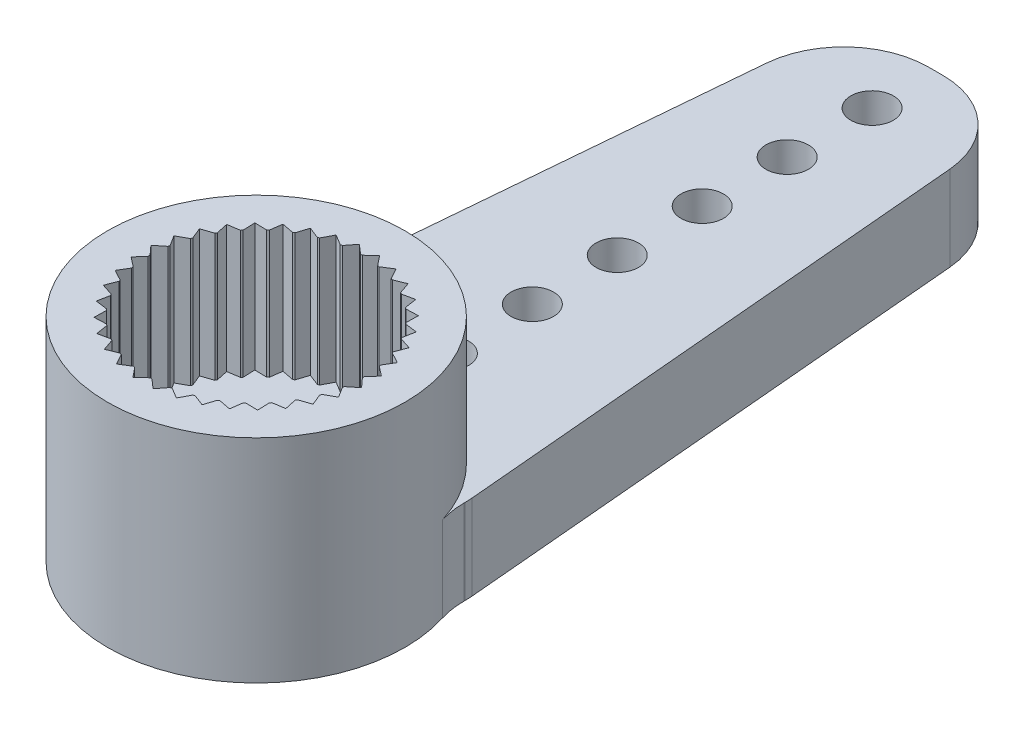
from build123d import *

# Parameters (mm, degrees)
BOSS_EXTRUDE1_DEPTH      = 2
FILLET1_R                = 2
BOSS_EXTRUDE2_DEPTH      = 3
BOSS_EXTRUDE2_DEPTH_BACK = 2
SKETCH2_R                = 3.5
SKETCH3_R                = 2.5
CUT_EXTRUDE1_DEPTH       = 1
SKETCH4_R                = 1
CUT_EXTRUDE2_DEPTH       = 17.8597153
CUT_EXTRUDE3_START       = -3
SKETCH5_R                = 2.5
CUT_EXTRUDE3_DEPTH       = 3
CUT_EXTRUDE4_DEPTH       = 3
CIRPATTERN1_COUNT        = 36
SKETCH9_R                = 0.5
CUT_EXTRUDE5_DEPTH       = 18.12454379
LPATTERN1_COUNT          = 6
LPATTERN1_PITCH          = 2
FILLET3_R                = 2


with BuildPart() as part:
    # Sketch1 → Boss-Extrude1 (new body)
    with BuildSketch(Plane(origin=(0, 0, 0), x_dir=(1, 0, 0), z_dir=(0, 1, 0))):
        Polygon((-3.25, 0), (-3.25, 1.75), (-2, 16), (2, 16), (3.25, 1.75), (3.25, 0), align=None)
    extrude(amount=BOSS_EXTRUDE1_DEPTH)

    # Fillet1
    fillet1_edges = [part.edges().sort_by_distance(p)[0] for p in [
        (-2, 1, -16),
        (2, 1, -16),
    ]]
    fillet(fillet1_edges, radius=FILLET1_R)

    # Sketch2 → Boss-Extrude2 (add, two sides: drawn at the far end of the back side and taken through both)
    with BuildSketch(Plane(origin=(0, 2, 0), x_dir=(1, 0, 0), z_dir=(0, 1, 0)).offset(-BOSS_EXTRUDE2_DEPTH_BACK)):
        with Locations(Location((0, 0, 0), (0, 0, 270))):
            Circle(SKETCH2_R)
    extrude(amount=BOSS_EXTRUDE2_DEPTH + BOSS_EXTRUDE2_DEPTH_BACK)

    # Sketch3 → Cut-Extrude1 (cut)
    with BuildSketch(Plane(origin=(0, 0, 0), x_dir=(-1, 0, 0), z_dir=(0, -1, 0))):
        with Locations(Location((0, 0, 0), (0, 0, 90))):
            Circle(SKETCH3_R)
    extrude(amount=-CUT_EXTRUDE1_DEPTH, mode=Mode.SUBTRACT)

    # Sketch4 → Cut-Extrude2 (cut, through all)
    with BuildSketch(Plane(origin=(0, 1, 0), x_dir=(-1, 0, 0), z_dir=(0, -1, 0))):
        with Locations(Location((0, 0, 0), (0, 0, 90))):
            Circle(SKETCH4_R)
    extrude(amount=-CUT_EXTRUDE2_DEPTH, mode=Mode.SUBTRACT)

    # Sketch5 → Cut-Extrude3 (cut)
    with BuildSketch(Plane(origin=(0, 5, 0), x_dir=(1, 0, 0), z_dir=(0, 1, 0)).offset(CUT_EXTRUDE3_START)):
        with Locations(Location((0, 0, 0), (0, 0, 90))):
            Circle(SKETCH5_R)
    extrude(amount=CUT_EXTRUDE3_DEPTH, mode=Mode.SUBTRACT)

    # Sketch6 → Cut-Extrude4 (cut)
    with BuildSketch(Plane(origin=(0, 5, 0), x_dir=(1, 0, 0), z_dir=(0, 1, 0))):
        Polygon((-2.5, 0), (-2.691676801, 0.211839558), (-2.469220851, 0.391086163), align=None)
    cut_extrude4 = extrude(amount=-CUT_EXTRUDE4_DEPTH, mode=Mode.SUBTRACT)

    # CirPattern1: Cut-Extrude4 ×36 about axis
    cirpattern1_axis = Axis((0, 0, 0), (0, 1, 0))
    for i in range(1, CIRPATTERN1_COUNT):
        add(cut_extrude4.rotate(cirpattern1_axis, i * 360 / CIRPATTERN1_COUNT), mode=Mode.SUBTRACT)

    # Sketch9 → Cut-Extrude5 (cut, through all)
    with BuildSketch(Plane(origin=(0, 0, 0), x_dir=(-1, 0, 0), z_dir=(0, -1, 0))):
        with Locations(Location((0, 14.5, 0), (0, 0, 90))):
            Circle(SKETCH9_R)
    cut_extrude5 = extrude(amount=-CUT_EXTRUDE5_DEPTH, mode=Mode.SUBTRACT)

    # LPattern1: Cut-Extrude5 ×6
    with Locations(*[(0, 0, i * LPATTERN1_PITCH) for i in range(1, LPATTERN1_COUNT)]):
        add(cut_extrude5, mode=Mode.SUBTRACT)

    # Fillet3
    # the kernel refuses this fillet: 2 mm, written as the material it adds along each edge
    with BuildSketch(Plane(origin=(-3.25, 0, -1.299038106), x_dir=(0, 0, -1), z_dir=(0, 1, 0))) as fillet3_piece_1:
        with BuildLine():
            CenterArc((0.340321525, 2), FILLET3_R, 252.658557197, 17.341442803)
            ThreePointArc((-0.25580925, 0.090909091), (-0.127022856, 0.047935757), (0, 0))
            Line((0, 0), (0.340321525, 0))
        make_face()
    extrude(amount=2)
    with BuildSketch(Plane(origin=(3.25, 0, -1.299038106), x_dir=(0.3348614999479688, 0, 0.9422673590083636), z_dir=(0, 1, 0))) as fillet3_piece_2:
        with BuildLine():
            CenterArc((0.349049135, 1.998495294), FILLET3_R, 250.435883949, 17.341442803)
            Line((-0.320673865, 0.113960576), (0, 0))
            ThreePointArc((0, 0), (0.13574133, 0.002633235), (0.271482661, 0))
        make_face()
    extrude(amount=2)
    # the kernel refuses this fillet: 2 mm, written as the material it takes off along each edge
    with BuildSketch(Plane(origin=(3.25, -0.218878004, -1.75), x_dir=(0, 0, 1), z_dir=(0, 1, 0)), Plane(origin=(-3.25, -0.218878004, -1.75), x_dir=(0.08738374771484407, 0, -0.9961747239492218), z_dir=(0, 1, 0))) as fillet3_2_piece_1:
        with BuildLine():
            CenterArc((FILLET3_R * 0.043775600736, -FILLET3_R), FILLET3_R, 90, 5.013113755)
            Line((-FILLET3_R * 0.0436081469789, -FILLET3_R * 0.00382527605078), (0, 0))
            Line((0, 0), (FILLET3_R * 0.043775600736, 0))
        make_face()
    extrude(amount=2.437756007, mode=Mode.SUBTRACT)


solid = part.part
